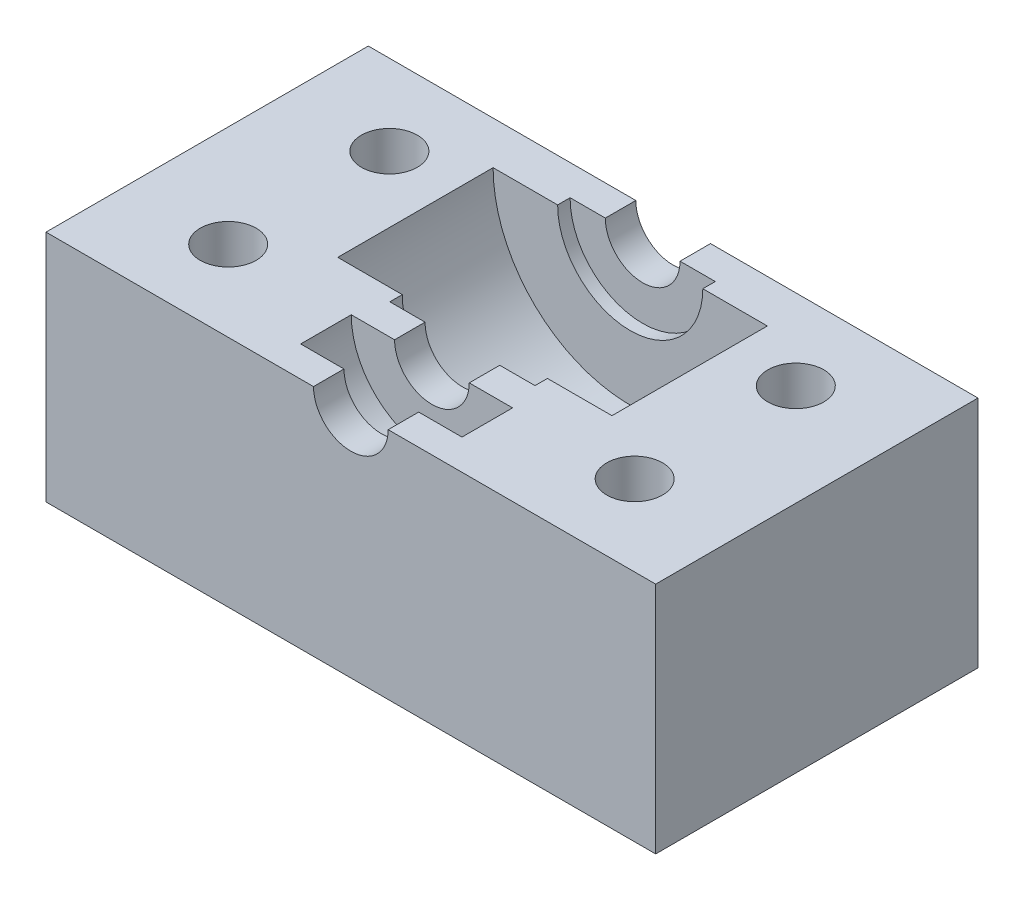
from build123d import *

# Parameters (mm, degrees)
BASE_BOSS_EXTRUDE_DEPTH                 = 23
CBORE_FOR_M5_HEX_HEAD_BOLT1_D           = 5.5
CBORE_FOR_M5_HEX_HEAD_BOLT1_CBORE_D     = 12.24
CBORE_FOR_M5_HEX_HEAD_BOLT1_CBORE_DEPTH = 3.58


with BuildPart() as part:
    # Lead Screw Pillow Block Sketch → Base Boss-Extrude (new body)
    with BuildSketch(Plane(origin=(0, 0, 0), x_dir=(1, 0, 0), z_dir=(0, 1, 0))):
        Polygon((30, 15.86015), (0, 15.86015), (0, 12.86015), (0, 11.6346), (0, -3.6562), (0, -4.88175), (0, -7.88175), (0, -12.86015), (0, -15.86015), (30, -15.86015), align=None)
    base_boss_extrude = extrude(amount=-BASE_BOSS_EXTRUDE_DEPTH)

    # Lead Screw Pillow Block Sketch<4> → Pillow Cut-Revolve (revolve, cut)
    with BuildSketch(Plane(origin=(0, 0, 0), x_dir=(1, 0, 0), z_dir=(0, 1, 0))):
        Polygon((0, 15.86015), (-3.675, 15.86015), (-3.675, 12.86015), (-7.14375, 12.86015), (-7.14375, 11.6346), (-13.49375, 11.6346), (-13.49375, -3.6562), (-7.14375, -3.6562), (-7.14375, -4.88175), (-3.675, -4.88175), (-3.675, -7.88175), (-7.9375, -7.88175), (-7.9375, -12.86015), (-3.675, -12.86015), (-3.675, -15.86015), (0, -15.86015), align=None)
    pillow_cut_revolve = revolve(axis=Axis((0, 0, -15.86015), (0, 0, 1)), mode=Mode.SUBTRACT)

    # CBORE for M5 Hex Head Bolt1 (through all)
    with Locations(Plane(origin=(0, -23, 0), x_dir=(-1, 0, 0), z_dir=(0, -1, 0))):
        with Locations((-20, 7.930075), (-20, -7.930075)):
            cbore_for_m5_hex_head_bolt1 = CounterBoreHole(CBORE_FOR_M5_HEX_HEAD_BOLT1_D / 2, CBORE_FOR_M5_HEX_HEAD_BOLT1_CBORE_D / 2, CBORE_FOR_M5_HEX_HEAD_BOLT1_CBORE_DEPTH)

    # Mirror1: Base Boss-Extrude, Pillow Cut-Revolve, CBORE for M5 Hex Head Bolt1 across plane
    add(base_boss_extrude.mirror(Plane(origin=(0, 0, 0), x_dir=(0, 0, 1), z_dir=(1, 0, 0))))
    add(pillow_cut_revolve.mirror(Plane(origin=(0, 0, 0), x_dir=(0, 0, 1), z_dir=(1, 0, 0))), mode=Mode.SUBTRACT)
    add(cbore_for_m5_hex_head_bolt1.mirror(Plane(origin=(0, 0, 0), x_dir=(0, 0, 1), z_dir=(1, 0, 0))), mode=Mode.SUBTRACT)


solid = part.part
